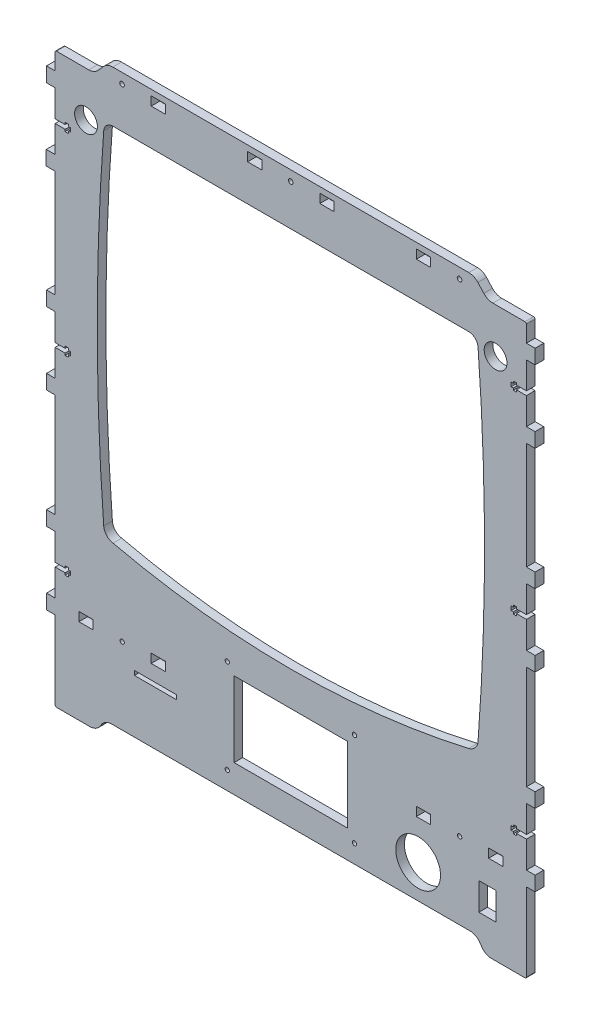
from build123d import *

# Parameters (mm, degrees)
SKETCH_1_R      = 1.5
SKETCH_1_R_2    = 15.5
SKETCH_1_R_3    = 1.6
SKETCH_1_R_4    = 7.9
SKETCH_1_W      = 9.849167249
SKETCH_1_H      = 6.199787221
SKETCH_1_W_2    = 9.849202526
SKETCH_1_W_3    = 9.849202527
SKETCH_1_H_2    = 6.19978722
SKETCH_1_W_4    = 9.849167497
SKETCH_1_W_5    = 78.6
SKETCH_1_H_3    = 52
SKETCH_1_W_6    = 12
SKETCH_1_H_4    = 19
SKETCH_1_W_7    = 29
SKETCH_1_H_5    = 3
EXTRUDE_2_DEPTH = 6


with BuildPart() as part:
    # Эскиз1 → Бобышка-Вытянуть2 (new body)
    with BuildSketch(Plane.XY):
        with BuildLine():
            Line((-162.349245127, -147.070399903), (-168.349245127, -147.070399903))
            Line((-168.349245127, -147.070399903), (-168.349245127, -136.97716367))
            Line((-168.349245127, -136.97716367), (-162.349245127, -136.97716367))
            Line((-162.349245127, -136.97716367), (-162.349245127, -118.36941157))
            Line((-162.349245127, -118.36941157), (-155.437302827, -118.36941157))
            Line((-155.437302827, -118.36941157), (-155.437302827, -119.769515594))
            Line((-155.437302827, -119.769515594), (-153.236480245, -119.769515594))
            Line((-153.236480245, -119.769515594), (-153.237302317, -118.369634629))
            Line((-153.237302317, -118.369634629), (-151.737302575, -118.368753763))
            Line((-151.737302575, -118.368753763), (-151.738946321, -115.569670957))
            Line((-151.738946321, -115.569670957), (-153.238946062, -115.570551823))
            Line((-153.238946062, -115.570551823), (-153.239768743, -114.169634568))
            Line((-153.239768743, -114.169634568), (-155.439769153, -114.169581228))
            Line((-155.439769153, -114.169581228), (-155.439803097, -115.569581227))
            Line((-155.439803097, -115.569581227), (-162.349245127, -115.568391292))
            Line((-162.349245127, -115.568391292), (-162.349245127, -96.987463802))
            Line((-162.349245127, -96.987463802), (-168.349245127, -96.987463802))
            Line((-168.349245127, -96.987463802), (-168.349245127, -86.987463802))
            Line((-168.349245127, -86.987463802), (-162.349245127, -86.987463802))
            Line((-162.349245127, -86.987463802), (-162.349245127, -15.257286387))
            Line((-162.349245127, -15.257286387), (-168.349245127, -15.257286387))
            Line((-168.349245127, -15.257286387), (-168.349245127, -5.28449447))
            Line((-168.349245127, -5.28449447), (-162.349245127, -5.28449447))
            Line((-162.349245127, -5.28449447), (-162.349245127, 13.318678649))
            Line((-162.349245127, 13.318678649), (-155.437302827, 13.318678649))
            Line((-155.437302827, 13.318678649), (-155.437302827, 11.918574624))
            Line((-155.437302827, 11.918574624), (-153.236480245, 11.918574624))
            Line((-153.236480245, 11.918574624), (-153.237302317, 13.318455589))
            Line((-153.237302317, 13.318455589), (-151.737302575, 13.319336455))
            Line((-151.737302575, 13.319336455), (-151.738946321, 16.145627343))
            Line((-151.738946321, 16.145627343), (-153.238946062, 16.144746477))
            Line((-153.238946062, 16.144746477), (-153.239768743, 17.545663732))
            Line((-153.239768743, 17.545663732), (-155.439769153, 17.545717073))
            Line((-155.439769153, 17.545717073), (-155.439803097, 16.145717073))
            Line((-155.439803097, 16.145717073), (-162.349245127, 16.146907008))
            Line((-162.349245127, 16.146907008), (-162.349245127, 34.744658398))
            Line((-162.349245127, 34.744658398), (-168.349245127, 34.744658398))
            Line((-168.349245127, 34.744658398), (-168.349245127, 44.717450316))
            Line((-168.349245127, 44.717450316), (-162.349245127, 44.717450316))
            Line((-162.349245127, 44.717450316), (-162.349245127, 118.881359411))
            Line((-162.349245127, 118.881359411), (-168.525304034, 118.881359411))
            Line((-168.525304034, 118.881359411), (-168.525304034, 128.881359411))
            Line((-168.525304034, 128.881359411), (-162.349245127, 128.881359411))
            Line((-162.349245127, 128.881359411), (-162.349245127, 147.485500282))
            Line((-162.349245127, 147.485500282), (-155.437302827, 147.485500282))
            Line((-155.437302827, 147.485500282), (-155.437302827, 146.085396258))
            Line((-155.437302827, 146.085396258), (-153.236480245, 146.085396258))
            Line((-153.236480245, 146.085396258), (-153.237302317, 147.485277222))
            Line((-153.237302317, 147.485277222), (-151.737302575, 147.486158088))
            Line((-151.737302575, 147.486158088), (-151.738946321, 150.285240894))
            Line((-151.738946321, 150.285240894), (-153.238946062, 150.284360028))
            Line((-153.238946062, 150.284360028), (-153.239768743, 151.685277283))
            Line((-153.239768743, 151.685277283), (-155.439769153, 151.685330623))
            Line((-155.439769153, 151.685330623), (-155.439803097, 150.285330624))
            Line((-155.439803097, 150.285330624), (-162.349245127, 150.286520559))
            Line((-162.349245127, 150.286520559), (-162.349245127, 168.8910255))
            Line((-162.349245127, 168.8910255), (-168.349245127, 168.8910255))
            Line((-168.349245127, 168.8910255), (-168.349245127, 179.033393664))
            Line((-168.349245127, 179.033393664), (-162.349245127, 179.033393664))
            Line((-162.349245127, 179.033393664), (-162.349245127, 190.291703157))
            ThreePointArc((-162.349245127, 190.291703157), (-162.144381362, 190.962346945), (-161.525304034, 191.291703157))
            Line((-161.525304034, 191.291703157), (-139.092392644, 191.291703157))
            ThreePointArc((-139.092392644, 191.291703157), (-135.666701236, 192.012587631), (-132.82207518, 194.052964716))
            Line((-132.82207518, 194.052964716), (-128.724185584, 198.530441598))
            ThreePointArc((-128.724185584, 198.530441598), (-125.879559527, 200.570818684), (-122.453868119, 201.291703157))
            Line((-122.453868119, 201.291703157), (123.955377865, 201.291703157))
            ThreePointArc((123.955377865, 201.291703157), (127.381069274, 200.570818684), (130.22569533, 198.530441598))
            Line((130.22569533, 198.530441598), (134.323584926, 194.052964716))
            ThreePointArc((134.323584926, 194.052964716), (137.168210982, 192.012587631), (140.59390239, 191.291703157))
            Line((140.59390239, 191.291703157), (162.850754873, 191.291703157))
            ThreePointArc((162.850754873, 191.291703157), (163.557861654, 190.998809938), (163.850754873, 190.291703157))
            Line((163.850754873, 190.291703157), (163.850754873, 178.8910255))
            Line((163.850754873, 178.8910255), (169.850754873, 178.8910255))
            Line((169.850754873, 178.8910255), (169.850754873, 168.8910255))
            Line((169.850754873, 168.8910255), (163.850754873, 168.8910255))
            Line((163.850754873, 168.8910255), (163.850754873, 150.286520559))
            Line((163.850754873, 150.286520559), (156.938753666, 150.286520559))
            Line((156.938753666, 150.286520559), (156.938753666, 151.686624583))
            Line((156.938753666, 151.686624583), (154.737931084, 151.686624583))
            Line((154.737931084, 151.686624583), (154.738753156, 150.286743619))
            Line((154.738753156, 150.286743619), (153.238753414, 150.285862752))
            Line((153.238753414, 150.285862752), (153.24039716, 147.486779946))
            Line((153.24039716, 147.486779946), (154.740396901, 147.487660813))
            Line((154.740396901, 147.487660813), (154.741219582, 146.086743558))
            Line((154.741219582, 146.086743558), (156.941219992, 146.086690217))
            Line((156.941219992, 146.086690217), (156.941253936, 147.486690217))
            Line((156.941253936, 147.486690217), (163.850754873, 147.485500282))
            Line((163.850754873, 147.485500282), (163.850754873, 128.881359411))
            Line((163.850754873, 128.881359411), (169.850754873, 128.881359411))
            Line((169.850754873, 128.881359411), (169.850754873, 118.881359411))
            Line((169.850754873, 118.881359411), (163.850754873, 118.881359411))
            Line((163.850754873, 118.881359411), (163.850754873, 44.717450316))
            Line((163.850754873, 44.717450316), (169.850754873, 44.717450316))
            Line((169.850754873, 44.717450316), (169.850754873, 34.744658398))
            Line((169.850754873, 34.744658398), (163.850754873, 34.744658398))
            Line((163.850754873, 34.744658398), (163.850754873, 16.14631204))
            Line((163.850754873, 16.14631204), (156.938753666, 16.14631204))
            Line((156.938753666, 16.14631204), (156.938753666, 17.519346859))
            Line((156.938753666, 17.519346859), (154.737931084, 17.519346859))
            Line((154.737931084, 17.519346859), (154.738753156, 16.1465351))
            Line((154.738753156, 16.1465351), (153.238753414, 16.145654234))
            Line((153.238753414, 16.145654234), (153.24039716, 13.346571428))
            Line((153.24039716, 13.346571428), (154.740396901, 13.347452294))
            Line((154.740396901, 13.347452294), (154.741219582, 11.946535039))
            Line((154.741219582, 11.946535039), (156.941219992, 11.946481699))
            Line((156.941219992, 11.946481699), (156.941253936, 13.346481698))
            Line((156.941253936, 13.346481698), (163.850754873, 13.345291763))
            Line((163.850754873, 13.345291763), (163.850754873, -5.28449447))
            Line((163.850754873, -5.28449447), (169.850754873, -5.28449447))
            Line((169.850754873, -5.28449447), (169.850754873, -15.257286387))
            Line((169.850754873, -15.257286387), (163.850754873, -15.257286387))
            Line((163.850754873, -15.257286387), (163.850754873, -86.987463802))
            Line((163.850754873, -86.987463802), (169.850754873, -86.987463802))
            Line((169.850754873, -86.987463802), (169.850754873, -96.987463802))
            Line((169.850754873, -96.987463802), (163.938754873, -96.987463802))
            Line((163.938754873, -96.987463802), (163.938754873, -115.569339038))
            Line((163.938754873, -115.569339038), (156.938753666, -115.569339038))
            Line((156.938753666, -115.569339038), (156.938753666, -114.169235013))
            Line((156.938753666, -114.169235013), (154.737931084, -114.169235013))
            Line((154.737931084, -114.169235013), (154.738753156, -115.569115978))
            Line((154.738753156, -115.569115978), (153.238753414, -115.569996844))
            Line((153.238753414, -115.569996844), (153.24039716, -118.36907965))
            Line((153.24039716, -118.36907965), (154.740396901, -118.368198784))
            Line((154.740396901, -118.368198784), (154.741219582, -119.769116039))
            Line((154.741219582, -119.769116039), (156.941219992, -119.769169379))
            Line((156.941219992, -119.769169379), (156.941253936, -118.36916938))
            Line((156.941253936, -118.36916938), (163.850754873, -118.370359315))
            Line((163.850754873, -118.370359315), (163.850754873, -136.97716367))
            Line((163.850754873, -136.97716367), (169.850754873, -136.97716367))
            Line((169.850754873, -136.97716367), (169.850754873, -146.97716367))
            Line((169.850754873, -146.97716367), (163.850754873, -146.97716367))
            Line((163.850754873, -146.97716367), (163.850754873, -201.019347794))
            ThreePointArc((163.850754873, -201.019347794), (163.513861654, -201.744679972), (162.762754873, -202.019347794))
            Line((162.762754873, -202.019347794), (139.726369967, -202.019347794))
            ThreePointArc((139.726369967, -202.019347794), (136.178114743, -201.213209419), (133.302992201, -198.983042476))
            Line((133.302992201, -198.983042476), (131.246288055, -195.963389381))
            ThreePointArc((131.246288055, -195.963389381), (128.327165513, -193.723467874), (124.734910288, -192.927084063))
            Line((124.734910288, -192.927084063), (-123.233400542, -192.927084063))
            ThreePointArc((-123.233400542, -192.927084063), (-126.825655767, -193.723467874), (-129.744778309, -195.963389381))
            Line((-129.744778309, -195.963389381), (-131.801482455, -198.983042476))
            ThreePointArc((-131.801482455, -198.983042476), (-134.720604996, -201.222963984), (-138.312860221, -202.019347794))
            Line((-138.312860221, -202.019347794), (-161.437304034, -202.019347794))
            ThreePointArc((-161.437304034, -202.019347794), (-162.100381362, -201.708216978), (-162.349245127, -201.019347794))
            Line((-162.349245127, -201.019347794), (-162.349245127, -147.070399903))
        make_face()
        with Locations((44.795753844, -115.425672952)):
            Circle(SKETCH_1_R, mode=Mode.SUBTRACT)
        with Locations((44.795753844, -180.425672952)):
            Circle(SKETCH_1_R, mode=Mode.SUBTRACT)
        with Locations((-43.204246156, -180.425672952)):
            Circle(SKETCH_1_R, mode=Mode.SUBTRACT)
        with Locations((-43.204246156, -115.425672952)):
            Circle(SKETCH_1_R, mode=Mode.SUBTRACT)
        with Locations((88.894233967, -169.827856004)):
            Circle(SKETCH_1_R_2, mode=Mode.SUBTRACT)
        with Locations((0.710817397, 194.241703157)):
            Circle(SKETCH_1_R_3, mode=Mode.SUBTRACT)
        with Locations((-116.049245127, 194.241703157)):
            Circle(SKETCH_1_R_3, mode=Mode.SUBTRACT)
        with Locations((117.550754873, 194.241703157)):
            Circle(SKETCH_1_R_3, mode=Mode.SUBTRACT)
        with Locations((-140.999245127, 160.291703157)):
            Circle(SKETCH_1_R_4, mode=Mode.SUBTRACT)
        with Locations((142.500754873, 160.291703157)):
            Circle(SKETCH_1_R_4, mode=Mode.SUBTRACT)
        with Locations((-115.945534431, -139.858846732)):
            Circle(SKETCH_1_R, mode=Mode.SUBTRACT)
        with Locations((117.64440268, -139.847693345)):
            Circle(SKETCH_1_R, mode=Mode.SUBTRACT)
        with Locations((-90.959719156, 194.249228604)):
            Rectangle(SKETCH_1_W, SKETCH_1_H, mode=Mode.SUBTRACT)
        with Locations((92.587043801, 194.249228604)):
            Rectangle(SKETCH_1_W_2, SKETCH_1_H, mode=Mode.SUBTRACT)
        with Locations((92.596004357, -139.827190453)):
            Rectangle(SKETCH_1_W_3, SKETCH_1_H_2, mode=Mode.SUBTRACT)
        with Locations((142.596061831, -139.827190453)):
            Rectangle(SKETCH_1_W, SKETCH_1_H_2, mode=Mode.SUBTRACT)
        with Locations((-140.9687188, -139.827190453)):
            Rectangle(SKETCH_1_W_4, SKETCH_1_H_2, mode=Mode.SUBTRACT)
        with Locations((-90.968662072, -139.827190453)):
            Rectangle(SKETCH_1_W_3, SKETCH_1_H_2, mode=Mode.SUBTRACT)
        with Locations((-24.186348776, 194.249228604)):
            Rectangle(SKETCH_1_W_3, SKETCH_1_H, mode=Mode.SUBTRACT)
        with Locations((25.81369106, 194.249228604)):
            Rectangle(SKETCH_1_W_2, SKETCH_1_H, mode=Mode.SUBTRACT)
        with BuildLine():
            Line((-122.192597833, 165.873018888), (123.830630504, 165.873018888))
            ThreePointArc((123.830630504, 165.873018888), (128.258284938, 164.15368067), (130.365274226, 159.896822222))
            ThreePointArc((130.365274226, 159.896822222), (134.836083817, 41.46068574), (130.331866171, -76.974184913))
            ThreePointArc((130.331866171, -76.974184913), (128.183821596, -81.497473491), (123.855438217, -84.015276578))
            ThreePointArc((123.855438217, -84.015276578), (0.79541861, -98.015276578), (-122.264600996, -84.015276578))
            ThreePointArc((-122.264600996, -84.015276578), (-126.723804725, -81.617901571), (-128.740683608, -76.974184913))
            ThreePointArc((-128.740683608, -76.974184913), (-133.230490231, 41.461567097), (-128.727595553, 159.896822224))
            ThreePointArc((-128.727595553, 159.896822224), (-126.639748548, 164.174875124), (-122.192597833, 165.873018888))
        make_face(mode=Mode.SUBTRACT)
        with Locations((0.795753844, -147.675672952)):
            Rectangle(SKETCH_1_W_5, SKETCH_1_H_3, mode=Mode.SUBTRACT)
        with Locations((136.938754873, -169.176180946)):
            Rectangle(SKETCH_1_W_6, SKETCH_1_H_4, mode=Mode.SUBTRACT)
        with Locations((-93.004246156, -154.427084063)):
            Rectangle(SKETCH_1_W_7, SKETCH_1_H_5, mode=Mode.SUBTRACT)
    extrude(amount=EXTRUDE_2_DEPTH)


solid = part.part
